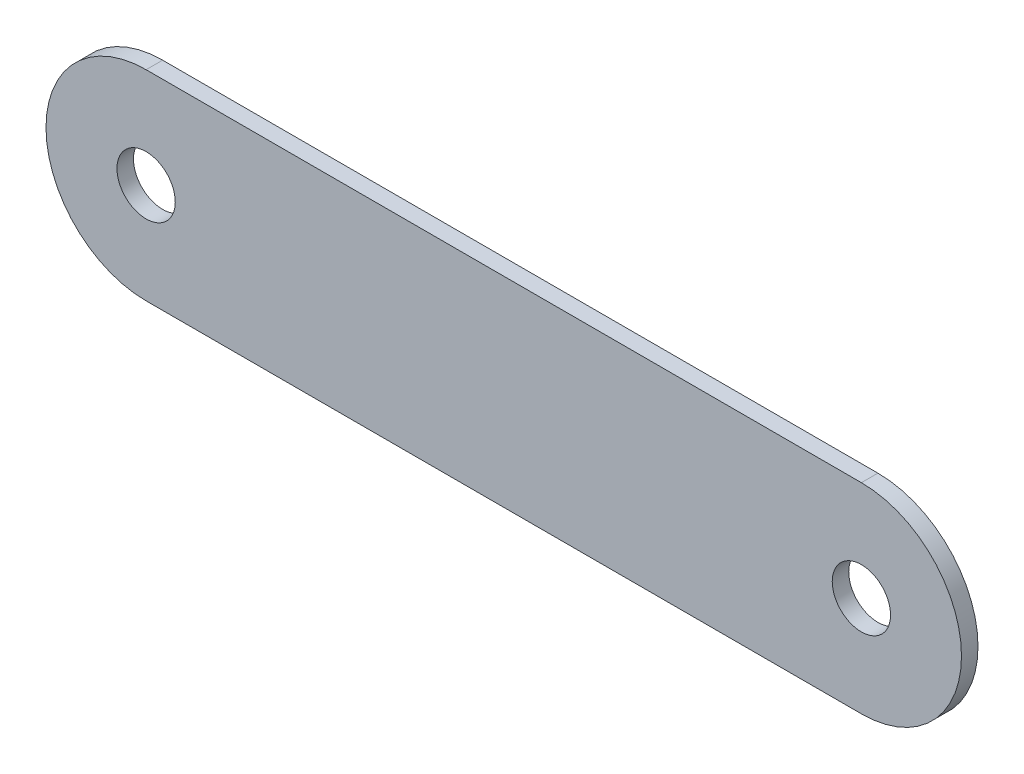
from build123d import *

# Parameters (mm, degrees)
SKETCH1_R           = 5.3
BOSS_EXTRUDE1_DEPTH = 3


with BuildPart() as part:
    # Sketch1 → Boss-Extrude1 (new body)
    with BuildSketch(Plane.XY):
        with BuildLine():
            Line((-65, 18.193025217), (65, 18.193025217))
            ThreePointArc((65, 18.193025217), (83.193025217, 0), (65, -18.193025217))
            Line((65, -18.193025217), (-65, -18.193025217))
            ThreePointArc((-65, -18.193025217), (-83.193025217, 0), (-65, 18.193025217))
        make_face()
        with Locations((-65, 0)):
            Circle(SKETCH1_R, mode=Mode.SUBTRACT)
        with Locations((65, 0)):
            Circle(SKETCH1_R, mode=Mode.SUBTRACT)
    extrude(amount=BOSS_EXTRUDE1_DEPTH)


solid = part.part
